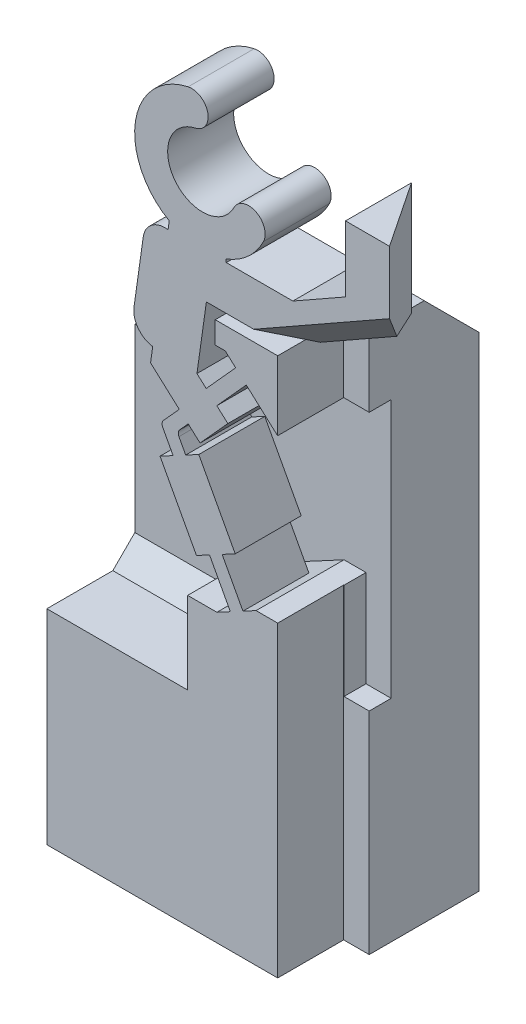
from build123d import *
from build123d.topology import SkipClean

# Parameters (mm, degrees)
BOSS_SWITCH_BODY_DEPTH                = 3
SKETCH1_W                             = 4
SKETCH1_H                             = 3.146726578
BOSS_FLANGE_WIDTH_DEPTH               = 5
BOSS_FLANGE_HEIGHT_REACH              = 32.536
SKETCH2_W                             = 4
SKETCH2_H                             = 3.146726578
SKETCH2_W_2                           = 8
SKETCH2_H_2                           = 2.29195361
SKETCH17_W                            = 11.655585698
SKETCH17_H                            = 4
BOSS_FLANGE_SUPPORT_DEPTH             = 12.061319812
CUT_WALL_GAP_DEPTH                    = 1
SKETCH26_W                            = 7.655585698
SKETCH26_H                            = 6
CUT_CAM_SLOPE_CLEARANCE_DEPTH         = 29.549094119
TAP_DRILL_FOR_M2X0_4_TAP1_D           = 1.6
M2_CLEARANCE_HOLE2_D                  = 2.4
M2_CLEARANCE_HOLE2_DEPTH              = 6.5
CUT_UP_TO_DOWN_CANTILEVER_SLOPE_REACH = 30.228
CHAMFER_FLANGE_SUPPORT_3_SIZE         = 1
CHAMFER7_SIZE                         = 1
SKETCH25_W                            = 6.448372016
SKETCH25_H                            = 17.5
CUT_BASE_REMOVAL_DEPTH                = 3
CHAMFER8_SIZE                         = 2.5
SKETCH28_R                            = 1.2
BOSS_REAR_FILL_DEPTH                  = 7


with BuildPart() as part:
    # Sketch-SwitchBossUp → Boss-Switch Body (new body)
    with BuildSketch(Plane.XY):
        with BuildLine():
            Line((10.004529844, 20.193518123), (10.004529844, 23.188250119))
            Line((10.004529844, 23.188250119), (12.004529844, 23.188250119))
            Line((12.004529844, 23.188250119), (12.004529844, 19.188250119))
            Line((12.004529844, 19.188250119), (7.857869287, 16.834427149))
            Line((7.857869287, 16.834427149), (3.678301726, 16.834427149))
            Line((3.678301726, 16.834427149), (3.249751742, 13.799610523))
            Line((3.249751742, 13.799610523), (3.669750435, 13.420459172))
            Line((3.669750435, 13.420459172), (5.009929091, 14.905020107))
            Line((5.009929091, 14.905020107), (4.534260481, 15.334427149))
            Line((4.534260481, 15.334427149), (4.080115542, 15.334427149))
            Line((4.080115542, 15.334427149), (4.080115542, 16.334427149))
            Line((4.080115542, 16.334427149), (7.056733116, 16.334427149))
            Line((7.056733116, 16.334427149), (13.368774055, 16.334427149))
            Line((13.368774055, 16.334427149), (13.368774055, -1.165572851))
            Line((13.368774055, -1.165572851), (5.219466869, -1.165572851))
            Line((5.219466869, -1.165572851), (3.260297574, -1.165572851))
            Line((3.260297574, -1.165572851), (3.260297574, 1.126380759))
            Line((3.260297574, 1.126380759), (2.82580452, 1.126380759))
            Line((2.82580452, 1.126380759), (2.82580452, 4.353442062))
            Line((2.82580452, 4.353442062), (2.82580452, 4.853442062))
            Line((2.82580452, 4.853442062), (4.157214411, 4.853442062))
            Line((4.157214411, 4.853442062), (4.768160192, 5.181708905))
            Line((4.768160192, 5.181708905), (3.821534656, 6.943497796))
            Line((3.821534656, 6.943497796), (3.226930905, 6.624011677))
            Line((3.226930905, 6.624011677), (1.570336216, 9.707142235))
            Line((1.570336216, 9.707142235), (2.164939967, 10.026628353))
            Line((2.164939967, 10.026628353), (1.692327837, 10.906218823))
            ThreePointArc((1.692327837, 10.906218823), (1.664368515, 11.054634089), (1.726981331, 11.192069347))
            Line((1.726981331, 11.192069347), (2.444726799, 11.987140122))
            Line((2.444726799, 11.987140122), (1.905726754, 12.473719244))
            Line((1.905726754, 12.473719244), (1.140258894, 13.164740854))
            Line((1.140258894, 13.164740854), (1.237885501, 13.856092765))
            ThreePointArc((1.237885501, 13.856092765), (0.578678558, 14.244979181), (0.38753308, 14.986093101))
            Line((0.38753308, 14.986093101), (0.807004952, 17.956622238))
            ThreePointArc((0.807004952, 17.956622238), (1.195891368, 18.61582918), (1.937005288, 18.806974659))
            Line((1.937005288, 18.806974659), (1.989924178, 19.181724706))
            ThreePointArc((1.989924178, 19.181724706), (0.451399887, 22.331599998), (2.848737223, 24.889244431))
            ThreePointArc((2.848737223, 24.889244431), (3.740925778, 24.315659579), (3.167340926, 23.423471024))
            ThreePointArc((3.167340926, 23.423471024), (2.253195858, 20.895301387), (4.927625811, 21.168664412))
            ThreePointArc((4.927625811, 21.168664412), (5.932330877, 21.508616953), (6.272283418, 20.503911887))
            ThreePointArc((6.272283418, 20.503911887), (5.572480513, 19.579545857), (4.581080915, 18.978460587))
            Line((4.581080915, 18.978460587), (4.581080915, 18.834427149))
            Line((4.581080915, 18.834427149), (7.610259328, 18.834427149))
            Line((7.610259328, 18.834427149), (10.004529844, 20.193518123))
        make_face()
        with BuildLine():
            Line((3.332125106, 10.653767771), (2.737521356, 10.334281653))
            Line((2.737521356, 10.334281653), (2.430214202, 10.906218823))
            ThreePointArc((2.430214202, 10.906218823), (2.40225488, 11.054634089), (2.464867696, 11.192069347))
            Line((2.464867696, 11.192069347), (2.851287644, 11.620119709))
            Line((2.851287644, 11.620119709), (3.390287689, 11.133540588))
            Line((3.390287689, 11.133540588), (4.653272054, 12.532590813))
            Line((4.653272054, 12.532590813), (4.152232739, 12.984901109))
            Line((4.152232739, 12.984901109), (5.492411395, 14.469462044))
            Line((5.492411395, 14.469462044), (6.912261653, 13.187700571))
            Line((6.912261653, 13.187700571), (10.437466736, 13.187700571))
            Line((10.437466736, 13.187700571), (10.437466736, 2.560049805))
            Line((10.437466736, 2.560049805), (9.303967163, 1.426550232))
            Line((9.303967163, 1.426550232), (6.935345332, 1.426550232))
            Line((6.935345332, 1.426550232), (6.935345332, 5.808848323))
            Line((6.935345332, 5.808848323), (5.935345332, 5.808848323))
            Line((5.935345332, 5.808848323), (5.340741582, 5.489362205))
            Line((5.340741582, 5.489362205), (4.394116045, 7.251151095))
            Line((4.394116045, 7.251151095), (4.988719795, 7.570637214))
            Line((4.988719795, 7.570637214), (3.332125106, 10.653767771))
        make_face(mode=Mode.SUBTRACT)
    extrude(amount=BOSS_SWITCH_BODY_DEPTH)

    # Sketch1 → Boss-Flange Width (add)
    with BuildSketch(Plane(origin=(0, 0, 0), x_dir=(-1, 0, 0), z_dir=(0, 0, -1))):
        Polygon((-6.935345332, 5.808848323), (-5.935345332, 5.808848323), (-4.157214411, 4.853442062), (-2.82580452, 4.853442062), (-2.82580452, 1.126380759), (0.412170615, 1.126380759), (0.412170615, -1.165572851), (-8.080115542, -1.165572851), (-8.080115542, 1.426550232), (-6.935345332, 1.426550232), align=None)
        with Locations((-6.080115542, 14.76106386)):
            Rectangle(SKETCH1_W, SKETCH1_H)
    extrude(amount=BOSS_FLANGE_WIDTH_DEPTH)

    # Sketch2 → Boss-Flange Height (add, up to next)
    with BuildSketch(Plane(origin=(-3.575470156, 0, 0), x_dir=(0, 0, -1), z_dir=(1, 0, 0)), mode=Mode.PRIVATE) as boss_flange_height_sk1:
        with Locations((3, 14.76106386)):
            Rectangle(SKETCH2_W, SKETCH2_H)
    boss_flange_height_tool1 = extrude(boss_flange_height_sk1.sketch, amount=BOSS_FLANGE_HEIGHT_REACH, mode=Mode.PRIVATE) - part.part
    # Sketch2 → Boss-Flange Height (add, up to next)
    with BuildSketch(Plane(origin=(-3.575470156, 0, 0), x_dir=(0, 0, -1), z_dir=(1, 0, 0)), mode=Mode.PRIVATE) as boss_flange_height_sk2:
        with Locations((1, -0.019596046)):
            Rectangle(SKETCH2_W_2, SKETCH2_H_2)
    boss_flange_height_tool2 = extrude(boss_flange_height_sk2.sketch, amount=BOSS_FLANGE_HEIGHT_REACH, mode=Mode.PRIVATE) - part.part
    add(boss_flange_height_tool1.solids().sort_by_distance((-3.57547, 14.761064, -3))[0])
    add(boss_flange_height_tool2.solids().sort_by_distance((-3.57547, -0.019596, -1))[0])

    # Sketch17 → Boss-Flange Support (add)
    with BuildSketch(Plane.XZ.offset(-1.126380759)):
        with Locations((2.252322693, -3)):
            Rectangle(SKETCH17_W, SKETCH17_H)
    extrude(amount=-BOSS_FLANGE_SUPPORT_DEPTH)

    # Sketch27 → Cut-Wall Gap (cut)
    with BuildSketch(Plane.XY):
        Polygon((4.080115542, 15.334427149), (4.534260481, 15.334427149), (6.912261653, 13.187700571), (4.080115542, 13.187700571), align=None)
    extrude(amount=-CUT_WALL_GAP_DEPTH, mode=Mode.SUBTRACT)

    # Sketch26 → Cut-Cam Slope Clearance (cut, through all)
    with BuildSketch(Plane.XY.offset(-1)):
        with Locations((0.252322693, 13.334427149)):
            Rectangle(SKETCH26_W, SKETCH26_H)
    extrude(amount=-CUT_CAM_SLOPE_CLEARANCE_DEPTH, mode=Mode.SUBTRACT)

    # Tap Drill for M2x0.4 Tap1 (through all)
    with Locations(Plane(origin=(0, -1.165572851, 0), x_dir=(-1, 0, 0), z_dir=(0, -1, 0))):
        with Locations((0.575470156, 3), (-5.580115542, 3)):
            Hole(TAP_DRILL_FOR_M2X0_4_TAP1_D / 2)

    # M2 Clearance Hole2
    with Locations(Plane.XZ.offset(1.165572851)):
        with Locations((-0.575470156, -3), (5.580115542, -3)):
            Hole(M2_CLEARANCE_HOLE2_D / 2, depth=M2_CLEARANCE_HOLE2_DEPTH)

    # Sketch12 → Cut-Up-to-Down Cantilever Slope (cut, up to next)
    with BuildSketch(Plane(origin=(0, 23.188250119, 0), x_dir=(1, 0, 0), z_dir=(0, 1, 0)), mode=Mode.PRIVATE) as cut_up_to_down_cantilever_slope_sk1:
        Polygon((10.004529844, 0), (12.004529844, -3), (12.004529844, 0), align=None)
    cut_up_to_down_cantilever_slope_tool1 = extrude(cut_up_to_down_cantilever_slope_sk1.sketch, amount=-CUT_UP_TO_DOWN_CANTILEVER_SLOPE_REACH, mode=Mode.PRIVATE) & part.part
    add(cut_up_to_down_cantilever_slope_tool1.solids().sort_by_distance((11.337863, 23.18825, 1))[0], mode=Mode.SUBTRACT)

    # Chamfer-Flange Support 3
    chamfer_flange_support_3_edges = [part.edges().sort_by_distance(p)[0] for p in [
        (-0.374832818, 1.126380759, -1),
    ]]
    chamfer(chamfer_flange_support_3_edges, length=CHAMFER_FLANGE_SUPPORT_3_SIZE)

    # Chamfer7
    chamfer7_edges = [part.edges().sort_by_distance(p)[0] for p in [
        (9.931199565, 18.011338634, 3),
    ]]
    chamfer(chamfer7_edges, length=CHAMFER7_SIZE)

    # Sketch25 → Cut-Base Removal (cut)
    with BuildSketch(Plane.XY.offset(3)):
        with Locations((10.144588047, 7.584427149)):
            Rectangle(SKETCH25_W, SKETCH25_H)
    extrude(amount=-CUT_BASE_REMOVAL_DEPTH, mode=Mode.SUBTRACT)

    # Chamfer8
    # the kernel refuses this chamfer: 2.5 mm, written as the material it takes off along each edge
    with BuildSketch(Plane(origin=(14.509323012, 16.334427149, -5), x_dir=(0, 0.027495876610586317, 0.9996219169112968), z_dir=(-1, 0, 0))) as chamfer8_piece_1:
        Polygon((CHAMFER8_SIZE * 0.999621916911, -CHAMFER8_SIZE * 0.0274958766106), (-CHAMFER8_SIZE * 0.0274958766106, -CHAMFER8_SIZE * 0.999621916911), (0, 0), align=None)
    extrude(amount=16.85841494, mode=Mode.SUBTRACT)

    # Sketch28 → Boss-Rear Fill (add)
    with SkipClean():  # the faces are left unmerged after this step: merging them gives an invalid solid
        with BuildSketch(Plane.XZ.offset(1.165572851)):
            Polygon((-3.575470156, 3), (6.920402039, 3), (6.920402039, 0), (8.080115542, 0), (8.080115542, -5), (-3.575470156, -5), align=None)
            with Locations((5.580115542, -3)):
                Circle(SKETCH28_R, mode=Mode.SUBTRACT)
            with Locations((-0.575470156, -3)):
                Circle(SKETCH28_R, mode=Mode.SUBTRACT)
        extrude(amount=BOSS_REAR_FILL_DEPTH)


solid = part.part
